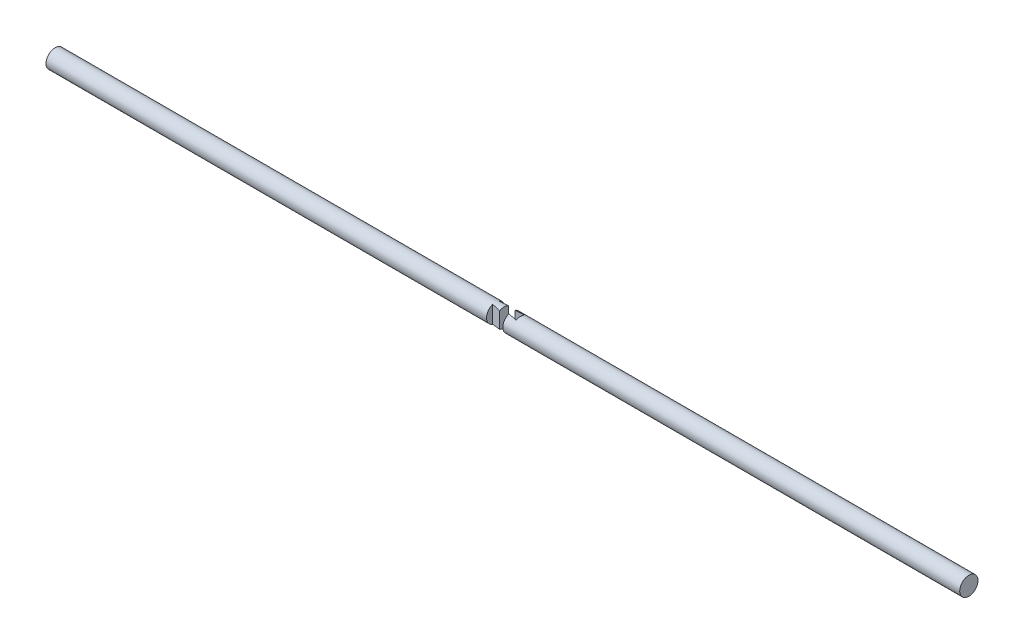
from build123d import *
from OCP.BRepAlgoAPI import BRepAlgoAPI_Cut
from OCP.TopTools import TopTools_ListOfShape

# Parameters (mm, degrees)
SKETCH1_R               = 4
BOSS_EXTRUDE1_DEPTH     = 400
CUT_EXTRUDE3_DEPTH      = 401.039998
CUT_EXTRUDE3_DEPTH_BACK = 401.039998


with BuildPart() as part:
    # Sketch1 → Boss-Extrude1 (new body)
    with BuildSketch(Plane(origin=(0, 0, 0), x_dir=(0, 0, -1), z_dir=(1, 0, 0))):
        Circle(SKETCH1_R)
    extrude(amount=BOSS_EXTRUDE1_DEPTH)


with BuildPart() as cut_extrude3_tool:
    # Sketch2 → Cut-Extrude3 (new, two sides: drawn at the far end of the back side and taken through both)
    with BuildSketch(Plane(origin=(0, 0, 0), x_dir=(1, 0, 0), z_dir=(0, 1, 0)).offset(-CUT_EXTRUDE3_DEPTH_BACK)):
        Polygon((199.985709439, 1.3), (200, 4), (192.851579286, 4.000000452), (192.837374297, 1.3), (196.580346974, 1.959987071), (196.580346974, -1.959987071), (192.837374297, -1.3), (192.851749918, -3.999999548), (200, -4), (199.985709439, -1.3), (203.728682116, -1.959987071), (203.728682116, 1.959987071), align=None)
    extrude(amount=CUT_EXTRUDE3_DEPTH + CUT_EXTRUDE3_DEPTH_BACK)


with BuildPart() as part_1:
    add(part.part)

    # Cut-Extrude3: cut by cut_extrude3_tool, with a tolerance
    cut_extrude3_stock = TopTools_ListOfShape()
    cut_extrude3_stock.Append(part_1.part.wrapped)
    cut_extrude3_tools = TopTools_ListOfShape()
    cut_extrude3_tools.Append(cut_extrude3_tool.part.wrapped)
    cut_extrude3_cut = BRepAlgoAPI_Cut()
    cut_extrude3_cut.SetArguments(cut_extrude3_stock)
    cut_extrude3_cut.SetTools(cut_extrude3_tools)
    cut_extrude3_cut.SetFuzzyValue(0.00001)
    cut_extrude3_cut.Build()
    add(Compound.cast(cut_extrude3_cut.Shape()).solids(), mode=Mode.REPLACE)


with BuildPart() as cut_extrude3_piece_1:
    # of the separate pieces the step leaves, piece 1, a body of its own (cut_extrude3_pieces)
    add(part_1.part.solids().sort_by_distance((199.985709439, 3.782856064, -1.3))[0])


with BuildPart() as cut_extrude3_piece_2:
    # of the separate pieces the step leaves, piece 2, a body of its own (cut_extrude3_pieces)
    add(part_1.part.solids().sort_by_distance((0, 0, -4))[0])


solid = Compound([cut_extrude3_piece_1.part, cut_extrude3_piece_2.part])
